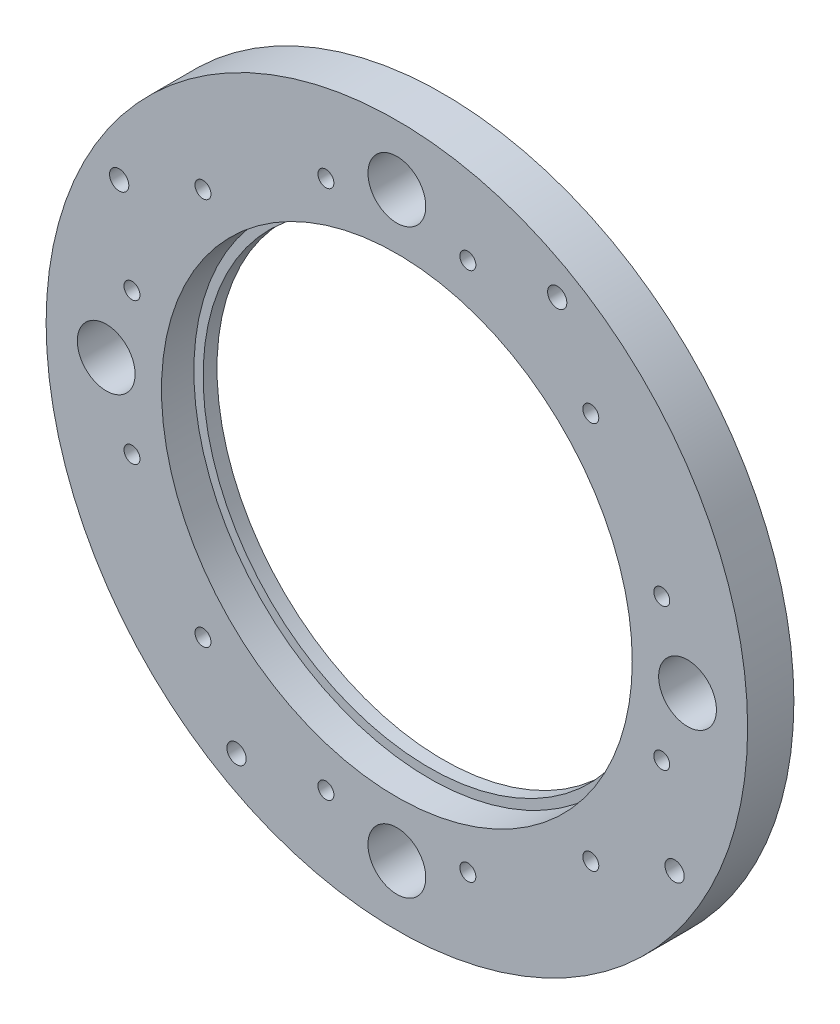
from build123d import *

# Parameters (mm, degrees)
SKETCH1_W                                = 75.85
SKETCH1_H                                = 10
M3_5_CLEARANCE_HOLE1_D                   = 4.1656
M3_CLEARANCE_HOLE1_D                     = 3.4544
F_12_5_12_5_DIAMETER_HOLE1_D             = 12.5
CBORE_FOR_M90_HEX_HEAD_BOLT1_D           = 97.8
CBORE_FOR_M90_HEX_HEAD_BOLT1_CBORE_D     = 101.8
CBORE_FOR_M90_HEX_HEAD_BOLT1_CBORE_DEPTH = 7


with BuildPart() as part:
    # Sketch1 → Revolve1 (revolve)
    with BuildSketch(Plane.XZ):
        with Locations((37.925, 0)):
            Rectangle(SKETCH1_W, SKETCH1_H)
    revolve(axis=Axis((0, 0, 5), (0, 0, -1)))

    # M3.5 Clearance Hole1 (through all)
    with Locations(Plane(origin=(0, 0, -5), x_dir=(-1, 0, 0), z_dir=(0, 0, -1))):
        with Locations((60.051933549, 34.671), (-34.671, 60.051933549), (-60.051933549, -34.671), (34.671, -60.051933549)):
            Hole(M3_5_CLEARANCE_HOLE1_D / 2)

    # M3 Clearance Hole1 (through all)
    with Locations(Plane(origin=(0, 0, -5), x_dir=(-1, 0, 0), z_dir=(0, 0, -1))):
        with Locations((41.931432124, 41.931432124), (57.279401499, 15.347969375), (57.279401499, -15.347969375), (41.931432124, -41.931432124), (15.347969375, -57.279401499), (-15.347969375, -57.279401499), (-41.931432124, -41.931432124), (-57.279401499, -15.347969375), (-57.279401499, 15.347969375), (-41.931432124, 41.931432124), (-15.347969375, 57.279401499), (15.347969375, 57.279401499)):
            Hole(M3_CLEARANCE_HOLE1_D / 2)

    # Ø12.5 (12.5) Diameter Hole1 (through all)
    with Locations(Plane(origin=(0, 0, -5), x_dir=(-1, 0, 0), z_dir=(0, 0, -1))):
        with Locations((62.85, 0), (0, -62.85), (-62.85, 0), (0, 62.85)):
            Hole(F_12_5_12_5_DIAMETER_HOLE1_D / 2)

    # CBORE for M90 Hex Head Bolt1 (through all)
    with Locations(Plane.XY.offset(5)):
        with Locations((0, 0)):
            CounterBoreHole(CBORE_FOR_M90_HEX_HEAD_BOLT1_D / 2, CBORE_FOR_M90_HEX_HEAD_BOLT1_CBORE_D / 2, CBORE_FOR_M90_HEX_HEAD_BOLT1_CBORE_DEPTH)


solid = part.part
